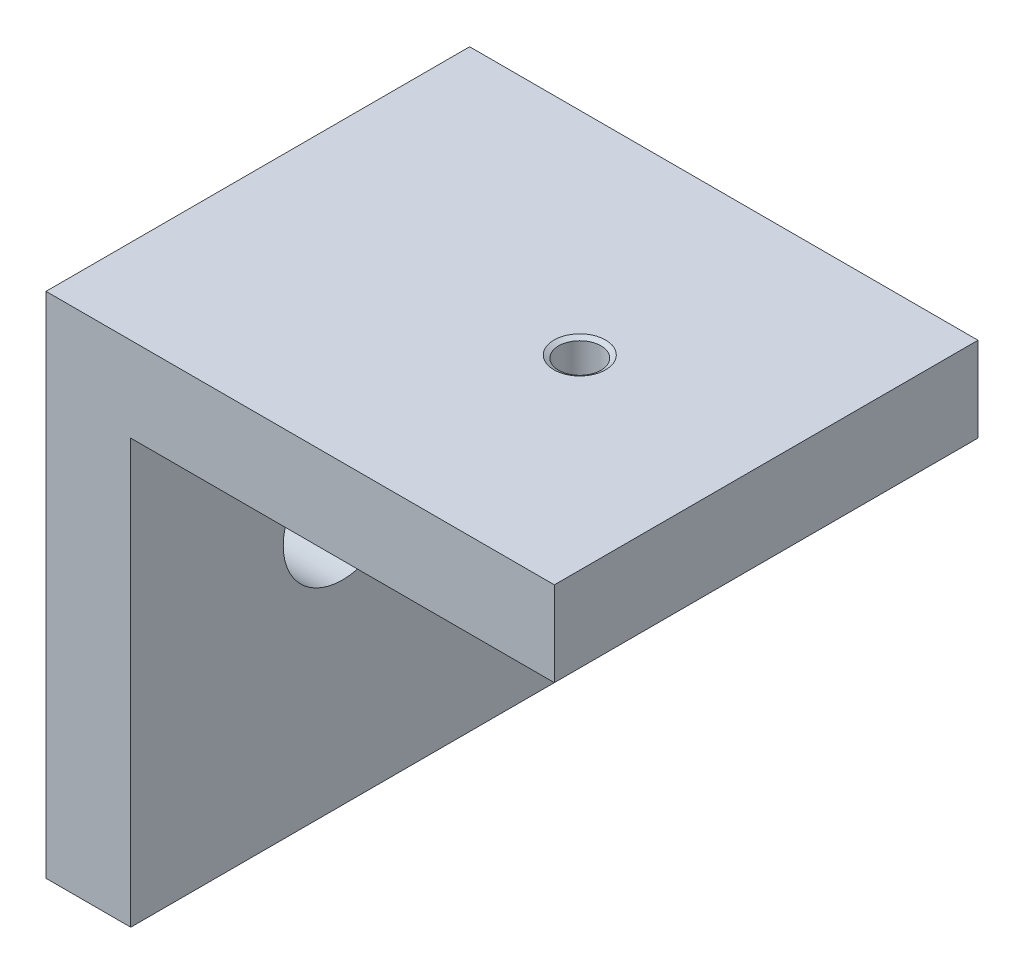
from build123d import *

# Parameters (mm, degrees)
ESTRUSIONE_ESTRUSIONE1_DEPTH    = 25
SCHIZZO2_R                      = 3.5
TAGLIO_ESTRUSIONE1_DEPTH        = 25
FORO_FILETTATO_M3_1_D           = 2.5
FORO_FILETTATO_M3_1_DEPTH       = 8.5
FORO_FILETTATO_M3_1_CSINK_D     = 3.05
FORO_FILETTATO_M3_1_CSINK_ANGLE = 120
FORO_FILETTATO_M3_1_TIP         = 0.751075774


with BuildPart() as part:
    # Schizzo1 → Estrusione-Estrusione1 (new body)
    with BuildSketch(Plane.XY):
        Polygon((0, 0), (0, 30), (30, 30), (30, 25), (5, 25), (5, 0), align=None)
    extrude(amount=ESTRUSIONE_ESTRUSIONE1_DEPTH)

    # Schizzo2 → Taglio-Estrusione1 (cut)
    with BuildSketch(Plane.ZY):
        with Locations((12.5, 15)):
            Circle(SCHIZZO2_R)
    extrude(amount=-TAGLIO_ESTRUSIONE1_DEPTH, mode=Mode.SUBTRACT)

    # Foro filettato M3-1
    with Locations(Plane(origin=(0, 30, 0), x_dir=(1, 0, 0), z_dir=(0, 1, 0))):
        with Locations((19, -12.5)):
            CounterSinkHole(FORO_FILETTATO_M3_1_D / 2, FORO_FILETTATO_M3_1_CSINK_D / 2, depth=FORO_FILETTATO_M3_1_DEPTH, counter_sink_angle=FORO_FILETTATO_M3_1_CSINK_ANGLE)
            with Locations((0, 0, -(FORO_FILETTATO_M3_1_DEPTH + FORO_FILETTATO_M3_1_TIP / 2))):  # 118° drill point
                Cone(0, FORO_FILETTATO_M3_1_D / 2, FORO_FILETTATO_M3_1_TIP, mode=Mode.SUBTRACT)


solid = part.part
